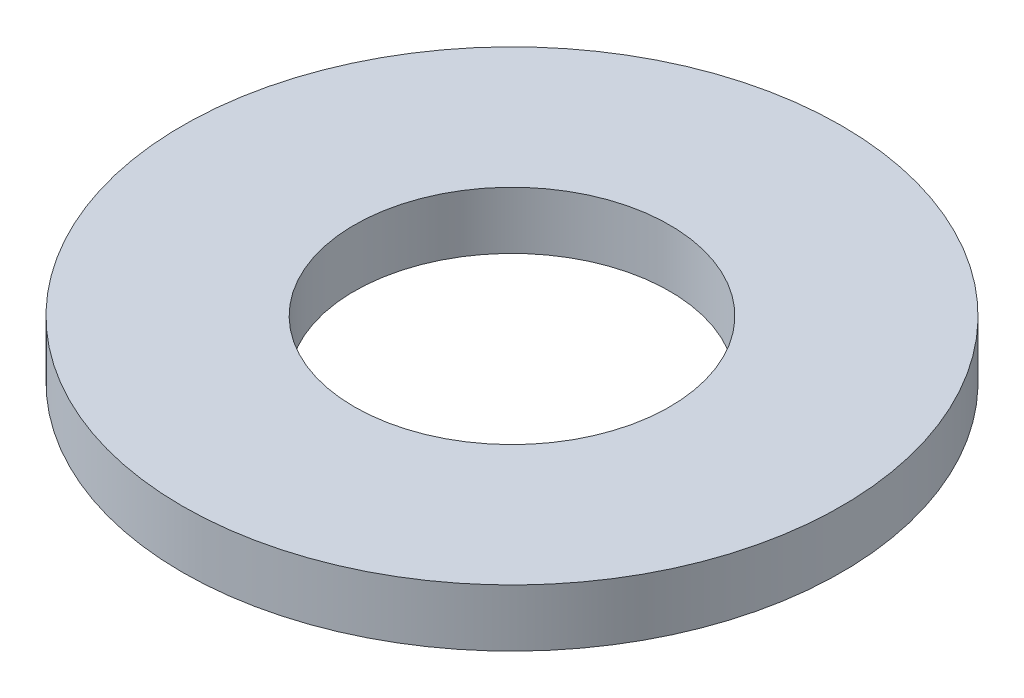
from build123d import *

# Parameters (mm, degrees)
SKETCH1_R           = 57.5
BOSS_EXTRUDE1_DEPTH = 10
SKETCH2_R           = 27.5
CUT_EXTRUDE1_DEPTH  = 82.929848041


with BuildPart() as part:
    # Sketch1 → Boss-Extrude1 (new body)
    with BuildSketch(Plane(origin=(0, 0, 0), x_dir=(1, 0, 0), z_dir=(0, 1, 0))):
        Circle(SKETCH1_R)
    extrude(amount=BOSS_EXTRUDE1_DEPTH)

    # Sketch2 → Cut-Extrude1 (cut, through all)
    with BuildSketch(Plane(origin=(0, 0, 0), x_dir=(1, 0, 0), z_dir=(0, 1, 0))):
        Circle(SKETCH2_R)
    extrude(amount=CUT_EXTRUDE1_DEPTH, mode=Mode.SUBTRACT)


solid = part.part
